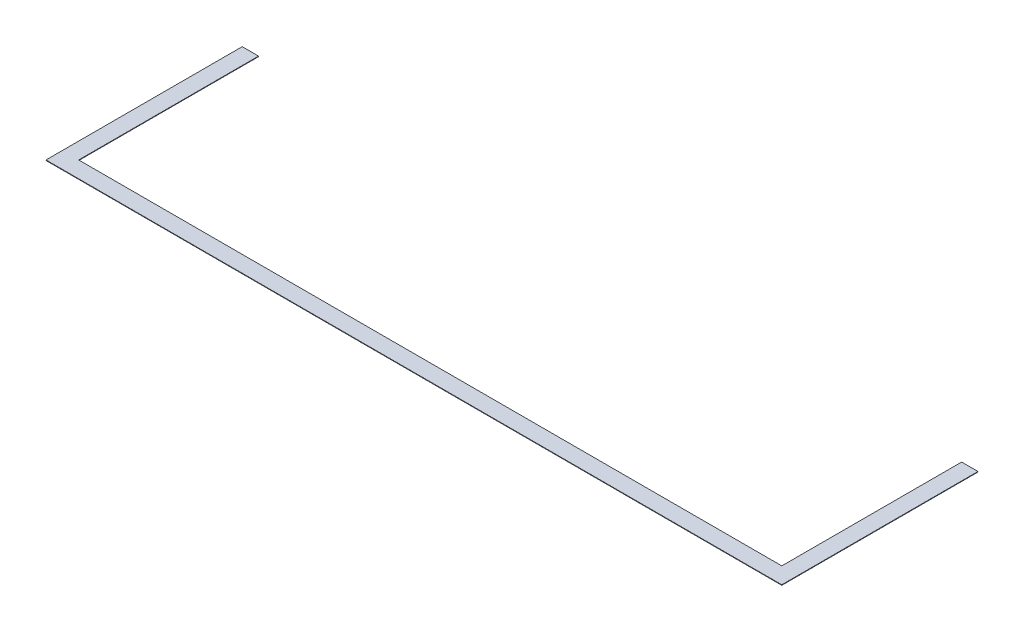
from build123d import *

# Parameters (mm, degrees)
BOSS_EXTRUDE1_DEPTH = 1.5875


with BuildPart() as part:
    # Sketch1 → Boss-Extrude1 (new body)
    with BuildSketch(Plane(origin=(0, 0, 0), x_dir=(1, 0, 0), z_dir=(0, 1, 0))):
        Polygon((50.8, 0), (0, 0), (0, -609.6), (2286, -609.6), (2286, 0), (2235.2, 0), (2235.2, -558.8), (50.8, -558.8), align=None)
    extrude(amount=BOSS_EXTRUDE1_DEPTH)


solid = part.part
